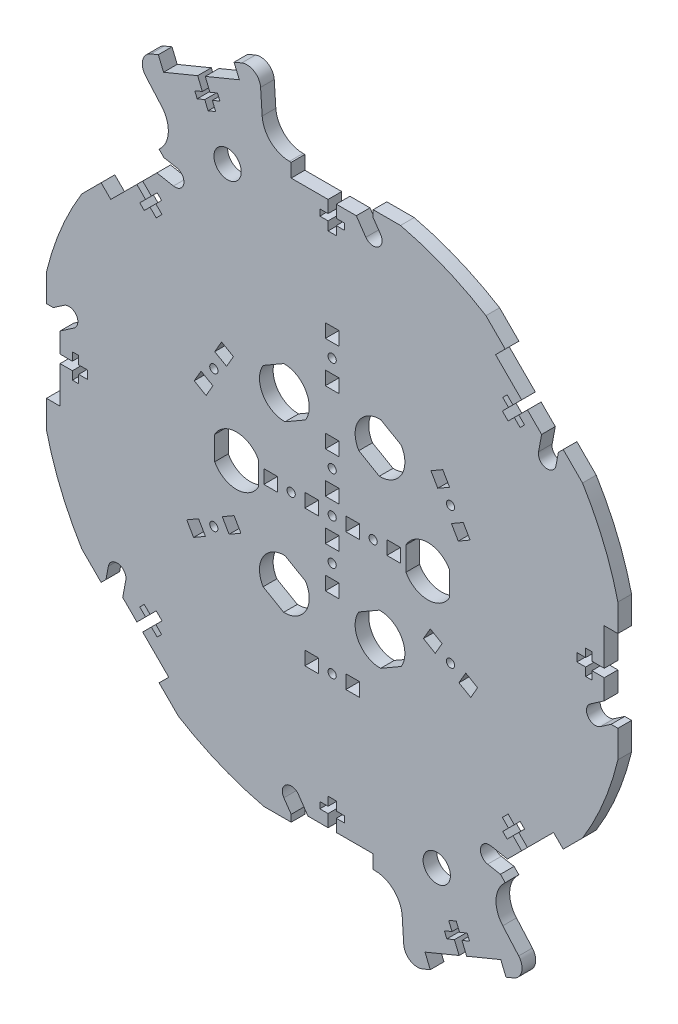
from build123d import *

# Parameters (mm, degrees)
BOSS_EXTRU_1_OUTLINE_W   = 5
BOSS_EXTRU_1_OUTLINE_H   = 5
BOSS_EXTRU_1_OUTLINE_R   = 1.5
BOSS_EXTRU_1_OUTLINE_R_2 = 5
BOSS_EXTRU_1_DEPTH       = 5
CONG_1_R                 = 10
CONG_2_R                 = 5


# Read off the part's stored shape, not the designer's step: Boss.-Extru.1
with BuildPart() as part:
    # Boss.-Extru.1 outline → Boss.-Extru.1 (new body)
    with BuildSketch(Plane.XY):
        with BuildLine():
            Line((-49.390639602, 107.480485297), (-50.270811496, 109.605408222))
            Line((-50.270811496, 109.605408222), (-47.499172899, 110.753458519))
            Line((-47.499172899, 110.753458519), (-49.221248344, 114.910916415))
            Line((-49.221248344, 114.910916415), (-61.693622033, 109.744690078))
            Line((-61.693622033, 109.744690078), (-63.607039195, 114.364087741))
            Line((-63.607039195, 114.364087741), (-72.84583452, 110.537253417))
            Line((-72.84583452, 110.537253417), (-56.252195883, 91.607534943))
            Line((-56.252195883, 91.607534943), (-63.323263695, 84.536467131))
            Line((-63.323263695, 84.536467131), (-61.555496742, 82.768700178))
            Line((-61.555496742, 82.768700178), (-56.8927604, 81.897557363))
            ThreePointArc((-56.8927604, 81.897557363), (-54.294911574, 78.105963836), (-58.086505101, 75.508115009))
            Line((-58.086505101, 75.508115009), (-64.148062345, 76.640600669))
            Line((-64.148062345, 76.640600669), (-69.333671335, 71.454991679))
            Line((-69.333671335, 71.454991679), (-66.15169082, 68.273011164))
            Line((-66.15169082, 68.273011164), (-64.030370476, 70.394331507))
            Line((-64.030370476, 70.394331507), (-62.40402488, 68.76798591))
            Line((-62.40402488, 68.76798591), (-64.525345223, 66.646665567))
            Line((-64.525345223, 66.646665567), (-62.262603524, 64.383923867))
            Line((-62.262603524, 64.383923867), (-64.383923867, 62.262603524))
            Line((-64.383923867, 62.262603524), (-66.646665567, 64.525345223))
            Line((-66.646665567, 64.525345223), (-68.76798591, 62.40402488))
            Line((-68.76798591, 62.40402488), (-70.394331507, 64.030370476))
            Line((-70.394331507, 64.030370476), (-68.273011164, 66.15169082))
            Line((-68.273011164, 66.15169082), (-71.454991679, 69.333671335))
            Line((-71.454991679, 69.333671335), (-81.000933225, 59.787729789))
            Line((-81.000933225, 59.787729789), (-84.536467131, 63.323263695))
            Line((-84.536467131, 63.323263695), (-91.607534943, 56.252195883))
            ThreePointArc((-91.607534943, 56.252195883), (-99.317049745, 41.138468979), (-104.552618332, 25))
            Line((-104.552618332, 25), (-104.552618332, 15))
            Line((-104.552618332, 15), (-102.052618332, 15))
            Line((-102.052618332, 15), (-98.139574853, 17.681061494))
            ThreePointArc((-98.139574853, 17.681061494), (-93.621556837, 16.836956522), (-94.46566181, 12.318938506))
            Line((-94.46566181, 12.318938506), (-99.552618332, 8.833558563))
            Line((-99.552618332, 8.833558563), (-99.552618332, 1.5))
            Line((-99.552618332, 1.5), (-95.052618332, 1.5))
            Line((-95.052618332, 1.5), (-95.052618332, 4.5))
            Line((-95.052618332, 4.5), (-92.752618332, 4.5))
            Line((-92.752618332, 4.5), (-92.752618332, 1.5))
            Line((-92.752618332, 1.5), (-89.552618332, 1.5))
            Line((-89.552618332, 1.5), (-89.552618332, -1.5))
            Line((-89.552618332, -1.5), (-92.752618332, -1.5))
            Line((-92.752618332, -1.5), (-92.752618332, -4.5))
            Line((-92.752618332, -4.5), (-95.052618332, -4.5))
            Line((-95.052618332, -4.5), (-95.052618332, -1.5))
            Line((-95.052618332, -1.5), (-99.552618332, -1.5))
            Line((-99.552618332, -1.5), (-99.552618332, -15))
            Line((-99.552618332, -15), (-104.552618332, -15))
            Line((-104.552618332, -15), (-104.552618332, -25))
            ThreePointArc((-104.552618332, -25), (-99.317049745, -41.138468979), (-91.607534943, -56.252195883))
            Line((-91.607534943, -56.252195883), (-84.536467131, -63.323263695))
            Line((-84.536467131, -63.323263695), (-82.768700178, -61.555496742))
            Line((-82.768700178, -61.555496742), (-81.897557363, -56.8927604))
            ThreePointArc((-81.897557363, -56.8927604), (-78.105963836, -54.294911574), (-75.508115009, -58.086505101))
            Line((-75.508115009, -58.086505101), (-76.640600669, -64.148062345))
            Line((-76.640600669, -64.148062345), (-71.454991679, -69.333671335))
            Line((-71.454991679, -69.333671335), (-68.273011164, -66.15169082))
            Line((-68.273011164, -66.15169082), (-70.394331507, -64.030370476))
            Line((-70.394331507, -64.030370476), (-68.76798591, -62.40402488))
            Line((-68.76798591, -62.40402488), (-66.646665567, -64.525345223))
            Line((-66.646665567, -64.525345223), (-64.383923867, -62.262603524))
            Line((-64.383923867, -62.262603524), (-62.262603524, -64.383923867))
            Line((-62.262603524, -64.383923867), (-64.525345223, -66.646665567))
            Line((-64.525345223, -66.646665567), (-62.40402488, -68.76798591))
            Line((-62.40402488, -68.76798591), (-64.030370476, -70.394331507))
            Line((-64.030370476, -70.394331507), (-66.15169082, -68.273011164))
            Line((-66.15169082, -68.273011164), (-69.333671335, -71.454991679))
            Line((-69.333671335, -71.454991679), (-59.787729789, -81.000933225))
            Line((-59.787729789, -81.000933225), (-63.323263695, -84.536467131))
            Line((-63.323263695, -84.536467131), (-56.252195883, -91.607534943))
            ThreePointArc((-56.252195883, -91.607534943), (-41.138468979, -99.317049745), (-25, -104.552618332))
            Line((-25, -104.552618332), (-15, -104.552618332))
            Line((-15, -104.552618332), (-15, -102.052618332))
            Line((-15, -102.052618332), (-17.681061494, -98.139574853))
            ThreePointArc((-17.681061494, -98.139574853), (-16.836956522, -93.621556837), (-12.318938506, -94.46566181))
            Line((-12.318938506, -94.46566181), (-8.833558563, -99.552618332))
            Line((-8.833558563, -99.552618332), (-1.5, -99.552618332))
            Line((-1.5, -99.552618332), (-1.5, -95.052618332))
            Line((-1.5, -95.052618332), (-4.5, -95.052618332))
            Line((-4.5, -95.052618332), (-4.5, -92.752618332))
            Line((-4.5, -92.752618332), (-1.5, -92.752618332))
            Line((-1.5, -92.752618332), (-1.5, -89.552618332))
            Line((-1.5, -89.552618332), (1.5, -89.552618332))
            Line((1.5, -89.552618332), (1.5, -92.752618332))
            Line((1.5, -92.752618332), (4.5, -92.752618332))
            Line((4.5, -92.752618332), (4.5, -95.052618332))
            Line((4.5, -95.052618332), (1.5, -95.052618332))
            Line((1.5, -95.052618332), (1.5, -99.552618332))
            Line((1.5, -99.552618332), (15, -99.552618332))
            Line((15, -99.552618332), (15, -104.552618332))
            Line((15, -104.552618332), (25, -104.552618332))
            Line((25, -104.552618332), (26.651857895, -129.671425036))
            Line((26.651857895, -129.671425036), (35.89065322, -125.844590712))
            Line((35.89065322, -125.844590712), (33.977236058, -121.225193049))
            Line((33.977236058, -121.225193049), (46.449609747, -116.058966712))
            Line((46.449609747, -116.058966712), (44.727534301, -111.901508816))
            Line((44.727534301, -111.901508816), (41.955895704, -113.049559113))
            Line((41.955895704, -113.049559113), (41.075723809, -110.924636188))
            Line((41.075723809, -110.924636188), (43.847362407, -109.776585891))
            Line((43.847362407, -109.776585891), (42.622775423, -106.820171387))
            Line((42.622775423, -106.820171387), (45.394414021, -105.67212109))
            Line((45.394414021, -105.67212109), (46.619001004, -108.628535594))
            Line((46.619001004, -108.628535594), (49.390639602, -107.480485297))
            Line((49.390639602, -107.480485297), (50.270811496, -109.605408222))
            Line((50.270811496, -109.605408222), (47.499172899, -110.753458519))
            Line((47.499172899, -110.753458519), (49.221248344, -114.910916415))
            Line((49.221248344, -114.910916415), (61.693622033, -109.744690078))
            Line((61.693622033, -109.744690078), (63.607039195, -114.364087741))
            Line((63.607039195, -114.364087741), (72.84583452, -110.537253417))
            Line((72.84583452, -110.537253417), (56.252195883, -91.607534943))
            Line((56.252195883, -91.607534943), (63.323263695, -84.536467131))
            Line((63.323263695, -84.536467131), (61.555496742, -82.768700178))
            Line((61.555496742, -82.768700178), (56.8927604, -81.897557363))
            ThreePointArc((56.8927604, -81.897557363), (54.294911574, -78.105963836), (58.086505101, -75.508115009))
            Line((58.086505101, -75.508115009), (64.148062345, -76.640600669))
            Line((64.148062345, -76.640600669), (69.333671335, -71.454991679))
            Line((69.333671335, -71.454991679), (66.15169082, -68.273011164))
            Line((66.15169082, -68.273011164), (64.030370476, -70.394331507))
            Line((64.030370476, -70.394331507), (62.40402488, -68.76798591))
            Line((62.40402488, -68.76798591), (64.525345223, -66.646665567))
            Line((64.525345223, -66.646665567), (62.262603524, -64.383923867))
            Line((62.262603524, -64.383923867), (64.383923867, -62.262603524))
            Line((64.383923867, -62.262603524), (66.646665567, -64.525345223))
            Line((66.646665567, -64.525345223), (68.76798591, -62.40402488))
            Line((68.76798591, -62.40402488), (70.394331507, -64.030370476))
            Line((70.394331507, -64.030370476), (68.273011164, -66.15169082))
            Line((68.273011164, -66.15169082), (71.454991679, -69.333671335))
            Line((71.454991679, -69.333671335), (81.000933225, -59.787729789))
            Line((81.000933225, -59.787729789), (84.536467131, -63.323263695))
            Line((84.536467131, -63.323263695), (91.607534943, -56.252195883))
            ThreePointArc((91.607534943, -56.252195883), (99.317049745, -41.138468979), (104.552618332, -25))
            Line((104.552618332, -25), (104.552618332, -15))
            Line((104.552618332, -15), (102.052618332, -15))
            Line((102.052618332, -15), (98.139574853, -17.681061494))
            ThreePointArc((98.139574853, -17.681061494), (93.621556837, -16.836956522), (94.46566181, -12.318938506))
            Line((94.46566181, -12.318938506), (99.552618332, -8.833558563))
            Line((99.552618332, -8.833558563), (99.552618332, -1.5))
            Line((99.552618332, -1.5), (95.052618332, -1.5))
            Line((95.052618332, -1.5), (95.052618332, -4.5))
            Line((95.052618332, -4.5), (92.752618332, -4.5))
            Line((92.752618332, -4.5), (92.752618332, -1.5))
            Line((92.752618332, -1.5), (89.552618332, -1.5))
            Line((89.552618332, -1.5), (89.552618332, 1.5))
            Line((89.552618332, 1.5), (92.752618332, 1.5))
            Line((92.752618332, 1.5), (92.752618332, 4.5))
            Line((92.752618332, 4.5), (95.052618332, 4.5))
            Line((95.052618332, 4.5), (95.052618332, 1.5))
            Line((95.052618332, 1.5), (99.552618332, 1.5))
            Line((99.552618332, 1.5), (99.552618332, 15))
            Line((99.552618332, 15), (104.552618332, 15))
            Line((104.552618332, 15), (104.552618332, 25))
            ThreePointArc((104.552618332, 25), (99.317049745, 41.138468979), (91.607534943, 56.252195883))
            Line((91.607534943, 56.252195883), (84.536467131, 63.323263695))
            Line((84.536467131, 63.323263695), (82.768700178, 61.555496742))
            Line((82.768700178, 61.555496742), (81.897557363, 56.8927604))
            ThreePointArc((81.897557363, 56.8927604), (78.105963836, 54.294911574), (75.508115009, 58.086505101))
            Line((75.508115009, 58.086505101), (76.640600669, 64.148062345))
            Line((76.640600669, 64.148062345), (71.454991679, 69.333671335))
            Line((71.454991679, 69.333671335), (68.273011164, 66.15169082))
            Line((68.273011164, 66.15169082), (70.394331507, 64.030370476))
            Line((70.394331507, 64.030370476), (68.76798591, 62.40402488))
            Line((68.76798591, 62.40402488), (66.646665567, 64.525345223))
            Line((66.646665567, 64.525345223), (64.383923867, 62.262603524))
            Line((64.383923867, 62.262603524), (62.262603524, 64.383923867))
            Line((62.262603524, 64.383923867), (64.525345223, 66.646665567))
            Line((64.525345223, 66.646665567), (62.40402488, 68.76798591))
            Line((62.40402488, 68.76798591), (64.030370476, 70.394331507))
            Line((64.030370476, 70.394331507), (66.15169082, 68.273011164))
            Line((66.15169082, 68.273011164), (69.333671335, 71.454991679))
            Line((69.333671335, 71.454991679), (59.787729789, 81.000933225))
            Line((59.787729789, 81.000933225), (63.323263695, 84.536467131))
            Line((63.323263695, 84.536467131), (56.252195883, 91.607534943))
            ThreePointArc((56.252195883, 91.607534943), (41.138468979, 99.317049745), (25, 104.552618332))
            Line((25, 104.552618332), (15, 104.552618332))
            Line((15, 104.552618332), (15, 102.052618332))
            Line((15, 102.052618332), (17.681061494, 98.139574853))
            ThreePointArc((17.681061494, 98.139574853), (16.836956522, 93.621556837), (12.318938506, 94.46566181))
            Line((12.318938506, 94.46566181), (8.833558563, 99.552618332))
            Line((8.833558563, 99.552618332), (1.5, 99.552618332))
            Line((1.5, 99.552618332), (1.5, 95.052618332))
            Line((1.5, 95.052618332), (4.5, 95.052618332))
            Line((4.5, 95.052618332), (4.5, 92.752618332))
            Line((4.5, 92.752618332), (1.5, 92.752618332))
            Line((1.5, 92.752618332), (1.5, 89.552618332))
            Line((1.5, 89.552618332), (-1.5, 89.552618332))
            Line((-1.5, 89.552618332), (-1.5, 92.752618332))
            Line((-1.5, 92.752618332), (-4.5, 92.752618332))
            Line((-4.5, 92.752618332), (-4.5, 95.052618332))
            Line((-4.5, 95.052618332), (-1.5, 95.052618332))
            Line((-1.5, 95.052618332), (-1.5, 99.552618332))
            Line((-1.5, 99.552618332), (-15, 99.552618332))
            Line((-15, 99.552618332), (-15, 104.552618332))
            Line((-15, 104.552618332), (-25, 104.552618332))
            Line((-25, 104.552618332), (-26.651857895, 129.671425036))
            Line((-26.651857895, 129.671425036), (-35.89065322, 125.844590712))
            Line((-35.89065322, 125.844590712), (-33.977236058, 121.225193049))
            Line((-33.977236058, 121.225193049), (-46.449609747, 116.058966712))
            Line((-46.449609747, 116.058966712), (-44.727534301, 111.901508816))
            Line((-44.727534301, 111.901508816), (-41.955895704, 113.049559113))
            Line((-41.955895704, 113.049559113), (-41.075723809, 110.924636188))
            Line((-41.075723809, 110.924636188), (-43.847362407, 109.776585891))
            Line((-43.847362407, 109.776585891), (-42.622775423, 106.820171387))
            Line((-42.622775423, 106.820171387), (-45.394414021, 105.67212109))
            Line((-45.394414021, 105.67212109), (-46.619001004, 108.628535594))
            Line((-46.619001004, 108.628535594), (-49.390639602, 107.480485297))
        make_face()
        with Locations((-7.5, -50)):
            Rectangle(BOSS_EXTRU_1_OUTLINE_W, BOSS_EXTRU_1_OUTLINE_H, mode=Mode.SUBTRACT)
        Polygon((-46.381397208, -29.665063509), (-50.711524227, -32.165063509), (-53.211524227, -27.834936491), (-48.881397208, -25.334936491), align=None, mode=Mode.SUBTRACT)
        with Locations((-43.301270189, -25)):
            Circle(BOSS_EXTRU_1_OUTLINE_R, mode=Mode.SUBTRACT)
        Polygon((-40.22114317, -20.334936491), (-35.891016151, -17.834936491), (-33.391016151, -22.165063509), (-37.72114317, -24.665063509), align=None, mode=Mode.SUBTRACT)
        with BuildLine():
            Line((-17.255995208, -21.214161058), (-9.744004792, -25.551210746))
            ThreePointArc((-9.744004792, -25.551210746), (-9.619168826, -34.860889132), (-17.744004792, -39.407617207))
            Line((-17.744004792, -39.407617207), (-25.255995208, -35.070567519))
            ThreePointArc((-25.255995208, -35.070567519), (-25.380831175, -25.760889133), (-17.255995208, -21.214161058))
        make_face(mode=Mode.SUBTRACT)
        with Locations((38.268343237, -92.387953251)):
            Circle(BOSS_EXTRU_1_OUTLINE_R_2, mode=Mode.SUBTRACT)
        with Locations((0, -50)):
            Circle(BOSS_EXTRU_1_OUTLINE_R, mode=Mode.SUBTRACT)
        with Locations((7.5, -50)):
            Rectangle(BOSS_EXTRU_1_OUTLINE_W, BOSS_EXTRU_1_OUTLINE_H, mode=Mode.SUBTRACT)
        with Locations((0, -22.5)):
            Rectangle(BOSS_EXTRU_1_OUTLINE_W, BOSS_EXTRU_1_OUTLINE_H, mode=Mode.SUBTRACT)
        with BuildLine():
            Line((9.744004792, -25.551210746), (17.255995208, -21.214161058))
            ThreePointArc((17.255995208, -21.214161058), (25.380831175, -25.760889133), (25.255995208, -35.070567519))
            Line((25.255995208, -35.070567519), (17.744004792, -39.407617207))
            ThreePointArc((17.744004792, -39.407617207), (9.619168826, -34.860889132), (9.744004792, -25.551210746))
        make_face(mode=Mode.SUBTRACT)
        with Locations((0, -15)):
            Circle(BOSS_EXTRU_1_OUTLINE_R, mode=Mode.SUBTRACT)
        with Locations((0, -7.5)):
            Rectangle(BOSS_EXTRU_1_OUTLINE_W, BOSS_EXTRU_1_OUTLINE_H, mode=Mode.SUBTRACT)
        Polygon((37.72114317, -24.665063509), (33.391016151, -22.165063509), (35.891016151, -17.834936491), (40.22114317, -20.334936491), align=None, mode=Mode.SUBTRACT)
        with Locations((43.301270189, -25)):
            Circle(BOSS_EXTRU_1_OUTLINE_R, mode=Mode.SUBTRACT)
        Polygon((48.881397208, -25.334936491), (53.211524227, -27.834936491), (50.711524227, -32.165063509), (46.381397208, -29.665063509), align=None, mode=Mode.SUBTRACT)
        with BuildLine():
            Line((-27, 4.337049688), (-27, -4.337049688))
            ThreePointArc((-27, -4.337049688), (-35, -9.1), (-43, -4.337049688))
            Line((-43, -4.337049688), (-43, 4.337049688))
            ThreePointArc((-43, 4.337049688), (-35, 9.1), (-27, 4.337049688))
        make_face(mode=Mode.SUBTRACT)
        Polygon((-43.63620668, 19.419872981), (-46.13620668, 15.089745962), (-50.466333699, 17.589745962), (-47.966333699, 21.919872981), align=None, mode=Mode.SUBTRACT)
        with Locations((-43.301270189, 25)):
            Circle(BOSS_EXTRU_1_OUTLINE_R, mode=Mode.SUBTRACT)
        Polygon((-42.966333699, 30.580127019), (-40.466333699, 34.910254038), (-36.13620668, 32.410254038), (-38.63620668, 28.080127019), align=None, mode=Mode.SUBTRACT)
        with Locations((-22.5, 0)):
            Rectangle(BOSS_EXTRU_1_OUTLINE_W, BOSS_EXTRU_1_OUTLINE_H, mode=Mode.SUBTRACT)
        with Locations((-15, 0)):
            Circle(BOSS_EXTRU_1_OUTLINE_R, mode=Mode.SUBTRACT)
        with Locations((-7.5, 0)):
            Rectangle(BOSS_EXTRU_1_OUTLINE_W, BOSS_EXTRU_1_OUTLINE_H, mode=Mode.SUBTRACT)
        with BuildLine():
            Line((-9.744004792, 25.551210746), (-17.255995208, 21.214161058))
            ThreePointArc((-17.255995208, 21.214161058), (-25.380831175, 25.760889133), (-25.255995208, 35.070567519))
            Line((-25.255995208, 35.070567519), (-17.744004792, 39.407617207))
            ThreePointArc((-17.744004792, 39.407617207), (-9.619168826, 34.860889132), (-9.744004792, 25.551210746))
        make_face(mode=Mode.SUBTRACT)
        with Locations((-38.268343237, 92.387953251)):
            Circle(BOSS_EXTRU_1_OUTLINE_R_2, mode=Mode.SUBTRACT)
        Circle(BOSS_EXTRU_1_OUTLINE_R, mode=Mode.SUBTRACT)
        with Locations((0, 7.5)):
            Rectangle(BOSS_EXTRU_1_OUTLINE_W, BOSS_EXTRU_1_OUTLINE_H, mode=Mode.SUBTRACT)
        with Locations((7.5, 0)):
            Rectangle(BOSS_EXTRU_1_OUTLINE_W, BOSS_EXTRU_1_OUTLINE_H, mode=Mode.SUBTRACT)
        with Locations((0, 15)):
            Circle(BOSS_EXTRU_1_OUTLINE_R, mode=Mode.SUBTRACT)
        with Locations((15, 0)):
            Circle(BOSS_EXTRU_1_OUTLINE_R, mode=Mode.SUBTRACT)
        with Locations((22.5, 0)):
            Rectangle(BOSS_EXTRU_1_OUTLINE_W, BOSS_EXTRU_1_OUTLINE_H, mode=Mode.SUBTRACT)
        with Locations((0, 22.5)):
            Rectangle(BOSS_EXTRU_1_OUTLINE_W, BOSS_EXTRU_1_OUTLINE_H, mode=Mode.SUBTRACT)
        with BuildLine():
            Line((17.255995208, 21.214161058), (9.744004792, 25.551210746))
            ThreePointArc((9.744004792, 25.551210746), (9.619168826, 34.860889132), (17.744004792, 39.407617207))
            Line((17.744004792, 39.407617207), (25.255995208, 35.070567519))
            ThreePointArc((25.255995208, 35.070567519), (25.380831175, 25.760889133), (17.255995208, 21.214161058))
        make_face(mode=Mode.SUBTRACT)
        with BuildLine():
            Line((27, -4.337049688), (27, 4.337049688))
            ThreePointArc((27, 4.337049688), (35, 9.1), (43, 4.337049688))
            Line((43, 4.337049688), (43, -4.337049688))
            ThreePointArc((43, -4.337049688), (35, -9.1), (27, -4.337049688))
        make_face(mode=Mode.SUBTRACT)
        Polygon((47.966333699, 21.919872981), (50.466333699, 17.589745962), (46.13620668, 15.089745962), (43.63620668, 19.419872981), align=None, mode=Mode.SUBTRACT)
        with Locations((43.301270189, 25)):
            Circle(BOSS_EXTRU_1_OUTLINE_R, mode=Mode.SUBTRACT)
        Polygon((38.63620668, 28.080127019), (36.13620668, 32.410254038), (40.466333699, 34.910254038), (42.966333699, 30.580127019), align=None, mode=Mode.SUBTRACT)
        with Locations((0, 42.5)):
            Rectangle(BOSS_EXTRU_1_OUTLINE_W, BOSS_EXTRU_1_OUTLINE_H, mode=Mode.SUBTRACT)
        with Locations((0, 50)):
            Circle(BOSS_EXTRU_1_OUTLINE_R, mode=Mode.SUBTRACT)
        with Locations((0, 57.5)):
            Rectangle(BOSS_EXTRU_1_OUTLINE_W, BOSS_EXTRU_1_OUTLINE_H, mode=Mode.SUBTRACT)
    extrude(amount=BOSS_EXTRU_1_DEPTH)

    # Congé1
    cong_1_edges = [part.edges().sort_by_distance(p)[0] for p in [
        (-25, 104.552618332, 2.5),
        (56.252195883, -91.607534943, 2.5),
        (25, -104.552618332, 2.5),
        (-56.252195883, 91.607534943, 2.5),
    ]]
    fillet(cong_1_edges, radius=CONG_1_R)

    # Congé2
    cong_2_edges = [part.edges().sort_by_distance(p)[0] for p in [
        (-26.651857895, 129.671425036, 2.5),
        (72.84583452, -110.537253417, 2.5),
        (26.651857895, -129.671425036, 2.5),
        (-72.84583452, 110.537253417, 2.5),
    ]]
    fillet(cong_2_edges, radius=CONG_2_R)


solid = part.part
